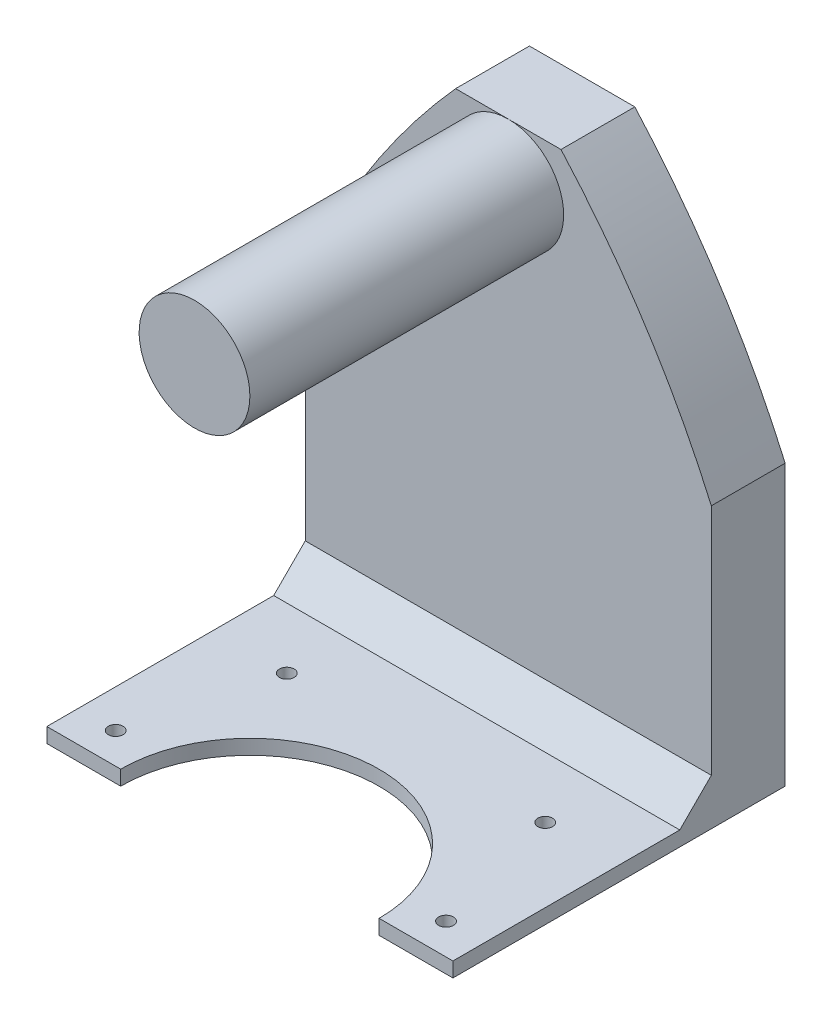
from build123d import *

# Parameters (mm, degrees)
SKETCH1_R           = 2
BOSS_EXTRUDE1_DEPTH = 4
SKETCH2_W           = 110
SKETCH2_H           = 20
BOSS_EXTRUDE2_DEPTH = 135
SKETCH3_W           = 110
SKETCH3_H           = 8.547835338
BOSS_EXTRUDE3_DEPTH = 10
CHAMFER1_SIZE       = 10
SKETCH4_R           = 15
BOSS_EXTRUDE4_DEPTH = 85
CUT_EXTRUDE1_DEPTH  = 85


with BuildPart() as part:
    # Sketch1 → Boss-Extrude1 (new body)
    with BuildSketch(Plane(origin=(0, 0, 0), x_dir=(1, 0, 0), z_dir=(0, 1, 0))):
        with BuildLine():
            Line((35, -45), (55, -45))
            Line((55, -45), (55, 45))
            Line((55, 45), (-55, 45))
            Line((-55, 45), (-55, -45))
            Line((-55, -45), (-35, -45))
            ThreePointArc((-35, -45), (0, -10), (35, -45))
        make_face()
        with Locations(Location((-35, 0, 0), (0, 0, 270))):
            Circle(SKETCH1_R, mode=Mode.SUBTRACT)
        with Locations(Location((35, 0, 0), (0, 0, 270))):
            Circle(SKETCH1_R, mode=Mode.SUBTRACT)
        with Locations(Location((-44.742033595, -36.607118396, 0), (0, 0, 270))):
            Circle(SKETCH1_R, mode=Mode.SUBTRACT)
        with Locations(Location((44.742033595, -36.607118396, 0), (0, 0, 270))):
            Circle(SKETCH1_R, mode=Mode.SUBTRACT)
    extrude(amount=BOSS_EXTRUDE1_DEPTH)



with BuildPart() as body_2:
    # Sketch2 → Boss-Extrude2 (new body)
    with BuildSketch(Plane(origin=(0, 4, 0), x_dir=(1, 0, 0), z_dir=(0, 1, 0))):
        with Locations((0, 35)):
            Rectangle(SKETCH2_W, SKETCH2_H)
    extrude(amount=BOSS_EXTRUDE2_DEPTH)


with BuildPart() as part_1:
    add(part.part)

    add(body_2.part)  # Boss-Extrude3 merges body 2
    # Sketch3 → Boss-Extrude3 (add)
    with BuildSketch(Plane(origin=(0, 4, 0), x_dir=(1, 0, 0), z_dir=(0, 1, 0))):
        with Locations((0, 20.726082331)):
            Rectangle(SKETCH3_W, SKETCH3_H)
    extrude(amount=BOSS_EXTRUDE3_DEPTH)

    # Chamfer1
    # the kernel refuses this chamfer: 10 mm, written as the material it takes off along each edge
    with BuildSketch(Plane(origin=(-80.71682988, 14, -16.452164662), x_dir=(0, -0.9996219169112968, 0.027495876610586317), z_dir=(1, 0, 0))) as chamfer1_piece_1_section:
        Polygon((CHAMFER1_SIZE * 0.999621916911, CHAMFER1_SIZE * 0.0274958766106), (-CHAMFER1_SIZE * 0.0274958766106, CHAMFER1_SIZE * 0.999621916911), (0, 0), align=None)
    chamfer1_piece_1 = extrude(amount=161.433659759, mode=Mode.PRIVATE)
    chamfer1_piece_1 = split(chamfer1_piece_1, bisect_by=Plane(origin=(0, 4, -19.564208601), z_dir=(0, 1, 0)), keep=Keep.TOP, mode=Mode.PRIVATE)
    chamfer1_piece_1 = split(chamfer1_piece_1, bisect_by=Plane(origin=(0, 10.613146748, -25), z_dir=(0, 0, 1)), keep=Keep.TOP, mode=Mode.PRIVATE)
    add(chamfer1_piece_1, mode=Mode.SUBTRACT)

    # Sketch4 → Boss-Extrude4 (add)
    with BuildSketch(Plane.XY.offset(-25)):
        with Locations(Location((0, 124, 0), (0, 0, 90))):
            Circle(SKETCH4_R)
    extrude(amount=BOSS_EXTRUDE4_DEPTH)

    # Sketch5 → Cut-Extrude1 (cut)
    with BuildSketch(Plane.XY.offset(-25)):
        with BuildLine():
            Line((-55, 139), (-55, 75.773917669))
            ThreePointArc((-55, 75.773917669), (-37.156416489, 109.008847521), (-14.276626111, 139))
            Line((-14.276626111, 139), (-55, 139))
        make_face()
        with BuildLine():
            Line((55, 139), (55, 75.773917669))
            ThreePointArc((55, 75.773917669), (37.156416489, 109.008847521), (14.276626111, 139))
            Line((14.276626111, 139), (55, 139))
        make_face()
    extrude(amount=-CUT_EXTRUDE1_DEPTH, mode=Mode.SUBTRACT)


solid = part_1.part
